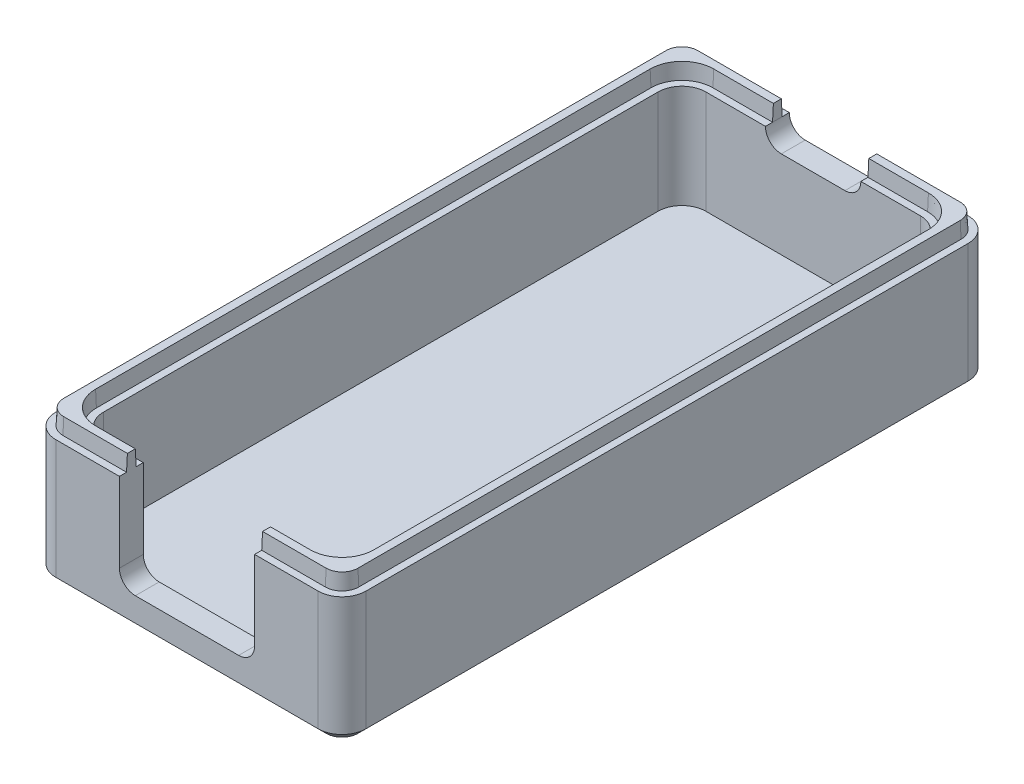
from build123d import *

# Parameters (mm, degrees)
SKETCH1_W                 = 39
SKETCH1_H                 = 81.75
BOSS_EXTRUDE1_DEPTH       = 3
SKETCH2_W                 = 39
SKETCH2_H                 = 81.75
SKETCH2_W_2               = 33
SKETCH2_H_2               = 75.75
BOSS_EXTRUDE2_DEPTH       = 15
SKETCH4_W                 = 17
SKETCH4_H                 = 3
CUT_EXTRUDE1_DEPTH        = 14
SKETCH4_3_W               = 12
SKETCH4_3_H               = 3
CUT_EXTRUDE2_DEPTH        = 4
FILLET1_R                 = 3
STANDOFFS1_GROOVE_DEPTH   = 2
STANDOFFS1_GROOVE_DRAFT   = -3
STANDOFFS1_GROOVE_2_DEPTH = 2
STANDOFFS1_GROOVE_2_DRAFT = -3
STANDOFFS2_GROOVE_DEPTH   = 2
STANDOFFS2_GROOVE_DRAFT   = -3
STANDOFFS2_GROOVE_2_DEPTH = 2
STANDOFFS2_GROOVE_2_DRAFT = -3
FILLET2_R                 = 2
CHAMFER1_SIZE             = 1


# Read off the part's stored shape, not the designer's step: Standoffs1-Groove, Standoffs2-Groove
with BuildPart() as part:
    # Sketch1 → Boss-Extrude1 (new body)
    with BuildSketch(Plane(origin=(0, 0, 0), x_dir=(1, 0, 0), z_dir=(0, 1, 0))):
        with Locations((19.5, 40.875)):
            Rectangle(SKETCH1_W, SKETCH1_H)
    extrude(amount=BOSS_EXTRUDE1_DEPTH)

    # Sketch2 → Boss-Extrude2 (add)
    with BuildSketch(Plane(origin=(0, 3, 0), x_dir=(1, 0, 0), z_dir=(0, 1, 0))):
        with Locations((19.5, 40.875)):
            Rectangle(SKETCH2_W, SKETCH2_H)
        with Locations((19.5, 40.875)):
            Rectangle(SKETCH2_W_2, SKETCH2_H_2, mode=Mode.SUBTRACT)
    extrude(amount=BOSS_EXTRUDE2_DEPTH)

    # Sketch4 → Cut-Extrude1 (cut)
    with BuildSketch(Plane(origin=(0, 18, 0), x_dir=(1, 0, 0), z_dir=(0, 1, 0))):
        with Locations((19.5, 1.5)):
            Rectangle(SKETCH4_W, SKETCH4_H)
    extrude(amount=-CUT_EXTRUDE1_DEPTH, mode=Mode.SUBTRACT)

    # Sketch4<3> → Cut-Extrude2 (cut)
    with BuildSketch(Plane(origin=(0, 18, 0), x_dir=(1, 0, 0), z_dir=(0, 1, 0))):
        with Locations((19.5, 80.25)):
            Rectangle(SKETCH4_3_W, SKETCH4_3_H)
    extrude(amount=-CUT_EXTRUDE2_DEPTH, mode=Mode.SUBTRACT)

    # Fillet1
    fillet1_edges = [part.edges().sort_by_distance(p)[0] for p in [
        (3, 10.5, -78.75),
        (3, 10.5, -3),
        (36, 10.5, -3),
        (36, 10.5, -78.75),
        (0, 9, -81.75),
        (39, 9, -81.75),
        (39, 9, 0),
        (0, 9, 0),
    ]]
    fillet(fillet1_edges, radius=FILLET1_R)


with BuildPart() as standoffs1_groove_tool:
    # Standoffs1-Groove outline → Standoffs1-Groove (with draft: the straight prism first)
    with BuildSketch(Plane(origin=(0, 16, 0), x_dir=(1, 0, 0), z_dir=(0, 1, 0))):
        with BuildLine():
            Line((11, 0.895184441), (3, 0.895184441))
            ThreePointArc((3, 0.895184441), (1.511670645, 1.511670645), (0.895184441, 3))
            Line((0.895184441, 3), (0.895184441, 78.75))
            ThreePointArc((0.895184441, 78.75), (1.511670645, 80.238329355), (3, 80.854815559))
            Line((3, 80.854815559), (13.5, 80.854815559))
            Line((13.5, 80.854815559), (13.5, 81.75))
            Line((13.5, 81.75), (3, 81.75))
            ThreePointArc((3, 81.75), (0.878679656, 80.871320344), (0, 78.75))
            Line((0, 78.75), (0, 3))
            ThreePointArc((0, 3), (0.878679656, 0.878679656), (3, 0))
            Line((3, 0), (11, 0))
            Line((11, 0), (11, 0.895184441))
        make_face()
    extrude(amount=STANDOFFS1_GROOVE_DEPTH)
    # Standoffs1-Groove: the draft: its side faces are tilted about the plane it starts from
    standoffs1_groove_sides = [standoffs1_groove_tool.faces().sort_by_distance(p)[0] for p in [
        (7, 17, -0.895184441),
        (1.511670645, 17, -1.511670645),
        (0.895184441, 17, -40.875),
        (1.511670645, 17, -80.238329355),
        (8.25, 17, -80.854815559),
        (13.5, 17, -81.30240778),
        (8.25, 17, -81.75),
        (0.878679656, 17, -80.871320344),
        (0, 17, -40.875),
        (0.878679656, 17, -0.878679656),
        (7, 17, 0),
        (11, 17, -0.447592221),
    ]]
    draft(standoffs1_groove_sides, Plane(origin=(0, 16, 0), x_dir=(1, 0, 0), z_dir=(0, 1, 0)), STANDOFFS1_GROOVE_DRAFT)


with BuildPart() as part_1:
    add(part.part)

    # Standoffs1-Groove: cut by standoffs1_groove_tool
    add(standoffs1_groove_tool.part, mode=Mode.SUBTRACT)


with BuildPart() as standoffs1_groove_2_tool:
    # Standoffs1-Groove 2 outline → Standoffs1-Groove 2 (with draft: the straight prism first)
    with BuildSketch(Plane(origin=(0, 16, 0), x_dir=(1, 0, 0), z_dir=(0, 1, 0))):
        with BuildLine():
            Line((11, 3), (6, 3))
            ThreePointArc((6, 3), (3.878679656, 3.878679656), (3, 6))
            Line((3, 6), (3, 75.75))
            ThreePointArc((3, 75.75), (3.878679656, 77.871320344), (6, 78.75))
            Line((6, 78.75), (13.5, 78.75))
            Line((13.5, 78.75), (13.5, 79.645184441))
            Line((13.5, 79.645184441), (6, 79.645184441))
            ThreePointArc((6, 79.645184441), (3.245688667, 78.504311333), (2.104815559, 75.75))
            Line((2.104815559, 75.75), (2.104815559, 6))
            ThreePointArc((2.104815559, 6), (3.245688667, 3.245688667), (6, 2.104815559))
            Line((6, 2.104815559), (11, 2.104815559))
            Line((11, 2.104815559), (11, 3))
        make_face()
    extrude(amount=STANDOFFS1_GROOVE_2_DEPTH)
    # Standoffs1-Groove 2: the draft: its side faces are tilted about the plane it starts from
    standoffs1_groove_2_sides = [standoffs1_groove_2_tool.faces().sort_by_distance(p)[0] for p in [
        (3.245688667, 17, -78.504311333),
        (2.104815559, 17, -40.875),
        (3.245688667, 17, -3.245688667),
        (8.5, 17, -2.104815559),
        (11, 17, -2.552407779),
        (8.5, 17, -3),
        (3.878679656, 17, -3.878679656),
        (3, 17, -40.875),
        (3.878679656, 17, -77.871320344),
        (9.75, 17, -78.75),
        (13.5, 17, -79.19759222),
        (9.75, 17, -79.645184441),
    ]]
    draft(standoffs1_groove_2_sides, Plane(origin=(0, 16, 0), x_dir=(1, 0, 0), z_dir=(0, 1, 0)), STANDOFFS1_GROOVE_2_DRAFT)


with BuildPart() as part_2:
    add(part_1.part)

    # Standoffs1-Groove 2: cut by standoffs1_groove_2_tool
    add(standoffs1_groove_2_tool.part, mode=Mode.SUBTRACT)


with BuildPart() as standoffs2_groove_tool:
    # Standoffs2-Groove outline → Standoffs2-Groove (with draft: the straight prism first)
    with BuildSketch(Plane(origin=(0, 16, 0), x_dir=(1, 0, 0), z_dir=(0, 1, 0))):
        with BuildLine():
            Line((25.5, 81.75), (25.5, 80.854815559))
            Line((25.5, 80.854815559), (36, 80.854815559))
            ThreePointArc((36, 80.854815559), (37.488329355, 80.238329355), (38.104815559, 78.75))
            Line((38.104815559, 78.75), (38.104815559, 3))
            ThreePointArc((38.104815559, 3), (37.488329355, 1.511670645), (36, 0.895184441))
            Line((36, 0.895184441), (28, 0.895184441))
            Line((28, 0.895184441), (28, 0))
            Line((28, 0), (36, 0))
            ThreePointArc((36, 0), (38.121320344, 0.878679656), (39, 3))
            Line((39, 3), (39, 78.75))
            ThreePointArc((39, 78.75), (38.121320344, 80.871320344), (36, 81.75))
            Line((36, 81.75), (25.5, 81.75))
        make_face()
    extrude(amount=STANDOFFS2_GROOVE_DEPTH)
    # Standoffs2-Groove: the draft: its side faces are tilted about the plane it starts from
    standoffs2_groove_sides = [standoffs2_groove_tool.faces().sort_by_distance(p)[0] for p in [
        (25.5, 17, -81.30240778),
        (30.75, 17, -80.854815559),
        (37.488329355, 17, -80.238329355),
        (38.104815559, 17, -40.875),
        (37.488329355, 17, -1.511670645),
        (32, 17, -0.895184441),
        (28, 17, -0.447592221),
        (32, 17, 0),
        (38.121320344, 17, -0.878679656),
        (39, 17, -40.875),
        (38.121320344, 17, -80.871320344),
        (30.75, 17, -81.75),
    ]]
    draft(standoffs2_groove_sides, Plane(origin=(0, 16, 0), x_dir=(1, 0, 0), z_dir=(0, 1, 0)), STANDOFFS2_GROOVE_DRAFT)


with BuildPart() as part_3:
    add(part_2.part)

    # Standoffs2-Groove: cut by standoffs2_groove_tool
    add(standoffs2_groove_tool.part, mode=Mode.SUBTRACT)


with BuildPart() as standoffs2_groove_2_tool:
    # Standoffs2-Groove 2 outline → Standoffs2-Groove 2 (with draft: the straight prism first)
    with BuildSketch(Plane(origin=(0, 16, 0), x_dir=(1, 0, 0), z_dir=(0, 1, 0))):
        with BuildLine():
            Line((28, 3), (28, 2.104815559))
            Line((28, 2.104815559), (33, 2.104815559))
            ThreePointArc((33, 2.104815559), (35.754311333, 3.245688667), (36.895184441, 6))
            Line((36.895184441, 6), (36.895184441, 75.75))
            ThreePointArc((36.895184441, 75.75), (35.754311333, 78.504311333), (33, 79.645184441))
            Line((33, 79.645184441), (25.5, 79.645184441))
            Line((25.5, 79.645184441), (25.5, 78.75))
            Line((25.5, 78.75), (33, 78.75))
            ThreePointArc((33, 78.75), (35.121320344, 77.871320344), (36, 75.75))
            Line((36, 75.75), (36, 6))
            ThreePointArc((36, 6), (35.121320344, 3.878679656), (33, 3))
            Line((33, 3), (28, 3))
        make_face()
    extrude(amount=STANDOFFS2_GROOVE_2_DEPTH)
    # Standoffs2-Groove 2: the draft: its side faces are tilted about the plane it starts from
    standoffs2_groove_2_sides = [standoffs2_groove_2_tool.faces().sort_by_distance(p)[0] for p in [
        (30.5, 17, -3),
        (28, 17, -2.552407779),
        (30.5, 17, -2.104815559),
        (35.754311333, 17, -3.245688667),
        (36.895184441, 17, -40.875),
        (35.754311333, 17, -78.504311333),
        (29.25, 17, -79.645184441),
        (25.5, 17, -79.19759222),
        (29.25, 17, -78.75),
        (35.121320344, 17, -77.871320344),
        (36, 17, -40.875),
        (35.121320344, 17, -3.878679656),
    ]]
    draft(standoffs2_groove_2_sides, Plane(origin=(0, 16, 0), x_dir=(1, 0, 0), z_dir=(0, 1, 0)), STANDOFFS2_GROOVE_2_DRAFT)


with BuildPart() as part_4:
    add(part_3.part)

    # Standoffs2-Groove 2: cut by standoffs2_groove_2_tool
    add(standoffs2_groove_2_tool.part, mode=Mode.SUBTRACT)

    # Fillet2
    fillet2_edges = [part_4.edges().sort_by_distance(p)[0] for p in [
        (25.5, 14, -80.25),
        (13.5, 14, -80.25),
        (11, 4, -1.5),
        (28, 4, -1.5),
    ]]
    fillet(fillet2_edges, radius=FILLET2_R - 0.0001)  # a hair under: the kernel refuses the full size

    # Chamfer1
    chamfer1_edges = [part_4.edges().sort_by_distance(p)[0] for p in [
        (19.5, 0, 0),
        (0, 0, -40.875),
        (19.5, 0, -81.75),
        (39, 0, -40.875),
        (38.121320344, 0, -0.878679656),
        (0.878679656, 0, -80.871320344),
        (38.121320344, 0, -80.871320344),
        (0.878679656, 0, -0.878679656),
    ]]
    chamfer(chamfer1_edges, length=CHAMFER1_SIZE)


solid = part_4.part
